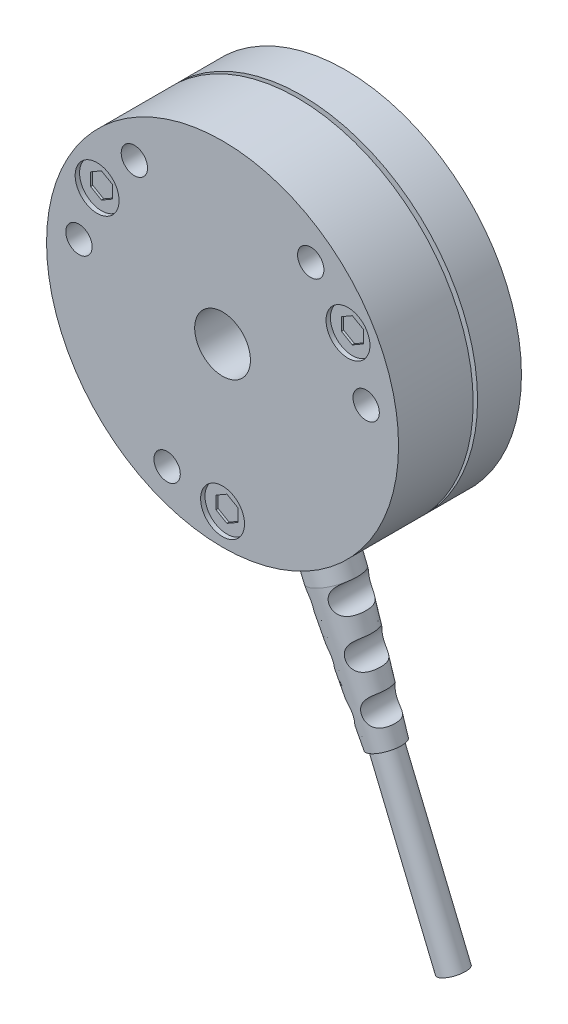
from build123d import *

# Parameters (mm, degrees)
SKETCH1_R           = 20.05
BOSS_EXTRUDE1_DEPTH = 5
SKETCH2_R           = 18.5
BOSS_EXTRUDE2_DEPTH = 0.5
SKETCH3_R           = 20.05
BOSS_EXTRUDE3_DEPTH = 8.5
SKETCH4_R           = 2.65
BOSS_EXTRUDE4_DEPTH = 37.35
CHAMFER1_SIZE       = 15
CHAMFER1_SIZE2      = 0.786116689
SKETCH5_R           = 1.5
BOSS_EXTRUDE5_DEPTH = 20
SKETCH6_R           = 1.5
CUT_EXTRUDE1_DEPTH  = 61.074372444
SKETCH9_R           = 2.5
CUT_EXTRUDE2_DEPTH  = 0.5
CUT_EXTRUDE3_DEPTH  = 0.25
SKETCH11_R          = 3.175
CUT_EXTRUDE4_DEPTH  = 61.07437242
SKETCH12_R          = 1.5
CUT_EXTRUDE5_DEPTH  = 5
SKETCH13_R          = 1.5
CUT_EXTRUDE6_DEPTH  = 5
SKETCH14_R          = 1.5
CUT_EXTRUDE7_DEPTH  = 5
SKETCH15_R          = 1.5
CUT_EXTRUDE8_DEPTH  = 5
SKETCH16_R          = 3.5
CUT_EXTRUDE9_DEPTH  = 0.5
CUT_EXTRUDE10_DEPTH = 0.25


with BuildPart() as part:
    # Sketch1 → Boss-Extrude1 (new body)
    with BuildSketch(Plane.XY):
        Circle(SKETCH1_R)
    extrude(amount=BOSS_EXTRUDE1_DEPTH)

    # Sketch2 → Boss-Extrude2 (add)
    with BuildSketch(Plane.XY.offset(5)):
        Circle(SKETCH2_R)
    extrude(amount=BOSS_EXTRUDE2_DEPTH)

    # Sketch3 → Boss-Extrude3 (add)
    with BuildSketch(Plane.XY.offset(5.5)):
        Circle(SKETCH3_R)
    extrude(amount=BOSS_EXTRUDE3_DEPTH)

    # Sketch4 → Boss-Extrude4 (add)
    with BuildSketch(Plane(origin=(0, 0, 0), x_dir=(0.9238795325112865, 0.38268343236509045, 0), z_dir=(-0.38268343236509045, 0.9238795325112865, 0))):
        with Locations((0, -9.65)):
            Circle(SKETCH4_R)
    extrude(amount=-BOSS_EXTRUDE4_DEPTH)

    # Chamfer1
    chamfer1_edges = [part.edges().sort_by_distance(p)[0] for p in [
        (11.844945438, -35.521011635, 9.65),
    ]]
    chamfer1_side = [part.faces().sort_by_distance(p)[0] for p in [
        (8.500185155, -27.446045997, 9.65),
    ]]
    chamfer(chamfer1_edges, length=CHAMFER1_SIZE, length2=CHAMFER1_SIZE2, reference=chamfer1_side[0])

    # Sketch5 → Boss-Extrude5 (add)
    with BuildSketch(Plane(origin=(14.293226199, -34.506900539, 0), x_dir=(-0.9238795325112865, -0.38268343236509045, 0), z_dir=(0.38268343236509045, -0.9238795325112865, 0))):
        with Locations((0, -9.65)):
            Circle(SKETCH5_R)
    extrude(amount=BOSS_EXTRUDE5_DEPTH)

    # Sketch6 → Cut-Extrude1 (cut, through all)
    with BuildSketch(Plane.XY):
        with Locations((11.501965763, -21.048558692)):
            Circle(SKETCH6_R)
        with Locations((13.173290552, -25.768234299)):
            Circle(SKETCH6_R)
        with Locations((14.844615341, -30.487909906)):
            Circle(SKETCH6_R)
        with Locations((11.061479667, -32.05493601)):
            Circle(SKETCH6_R)
        with Locations((8.905970132, -27.535816292)):
            Circle(SKETCH6_R)
        with Locations((6.750460597, -23.016696574)):
            Circle(SKETCH6_R)
    extrude(amount=CUT_EXTRUDE1_DEPTH, mode=Mode.SUBTRACT)

    # Sketch9 → Cut-Extrude2 (cut)
    with BuildSketch(Plane.XY.offset(14)):
        with Locations((0, -16.5)):
            Circle(SKETCH9_R)
        with Locations((-14.289419162, 8.25)):
            Circle(SKETCH9_R)
        with Locations((14.289419162, 8.25)):
            Circle(SKETCH9_R)
    extrude(amount=-CUT_EXTRUDE2_DEPTH, mode=Mode.SUBTRACT)

    # Sketch10 → Cut-Extrude3 (cut)
    with BuildSketch(Plane.XY.offset(13.5)):
        Polygon((-15.539419162, 8.971687836), (-15.539419162, 7.528312164), (-14.289419162, 6.806624327), (-13.039419162, 7.528312164), (-13.039419162, 8.971687836), (-14.289419162, 9.693375673), align=None)
        Polygon((0, -17.943375673), (1.25, -17.221687836), (1.25, -15.778312164), (0, -15.056624327), (-1.25, -15.778312164), (-1.25, -17.221687836), align=None)
        Polygon((15.539419162, 8.971687836), (14.289419162, 9.693375673), (13.039419162, 8.971687836), (13.039419162, 7.528312164), (14.289419162, 6.806624327), (15.539419162, 7.528312164), align=None)
    extrude(amount=-CUT_EXTRUDE3_DEPTH, mode=Mode.SUBTRACT)

    # Sketch11 → Cut-Extrude4 (cut, through all)
    with BuildSketch(Plane.XY.offset(14)):
        Circle(SKETCH11_R)
    extrude(amount=-CUT_EXTRUDE4_DEPTH, mode=Mode.SUBTRACT)

    # Sketch12 → Cut-Extrude5 (cut)
    with BuildSketch(Plane.XY.offset(14)):
        with Locations((-6.314276634, -15.244012286)):
            Circle(SKETCH12_R)
        with Locations((-10.044563579, 13.090330115)):
            Circle(SKETCH12_R)
        with Locations((16.358840213, 2.153682172)):
            Circle(SKETCH12_R)
    extrude(amount=-CUT_EXTRUDE5_DEPTH, mode=Mode.SUBTRACT)

    # Sketch13 → Cut-Extrude6 (cut)
    with BuildSketch(Plane.XY.offset(14)):
        with Locations((-16.358840213, 2.153682172)):
            Circle(SKETCH13_R)
        with Locations((10.044563579, 13.090330115)):
            Circle(SKETCH13_R)
    extrude(amount=-CUT_EXTRUDE6_DEPTH, mode=Mode.SUBTRACT)

    # Sketch14 → Cut-Extrude7 (cut)
    with BuildSketch(Plane(origin=(0, 0, 0), x_dir=(-1, 0, 0), z_dir=(0, 0, -1))):
        with Locations((0, -16.5)):
            Circle(SKETCH14_R)
        with Locations((-14.289419162, 8.25)):
            Circle(SKETCH14_R)
        with Locations((14.289419162, 8.25)):
            Circle(SKETCH14_R)
    extrude(amount=-CUT_EXTRUDE7_DEPTH, mode=Mode.SUBTRACT)

    # Sketch15 → Cut-Extrude8 (cut)
    with BuildSketch(Plane(origin=(0, 0, 0), x_dir=(-1, 0, 0), z_dir=(0, 0, -1))):
        with Locations((0, 17.5)):
            Circle(SKETCH15_R)
        with Locations((-15.155444566, -8.75)):
            Circle(SKETCH15_R)
    extrude(amount=-CUT_EXTRUDE8_DEPTH, mode=Mode.SUBTRACT)

    # Sketch16 → Cut-Extrude9 (cut)
    with BuildSketch(Plane(origin=(0, 0, 0), x_dir=(-1, 0, 0), z_dir=(0, 0, -1))):
        with Locations((0, -7.5)):
            Circle(SKETCH16_R)
        with Locations((-6.495190528, 3.75)):
            Circle(SKETCH16_R)
        with Locations((6.495190528, 3.75)):
            Circle(SKETCH16_R)
    extrude(amount=-CUT_EXTRUDE9_DEPTH, mode=Mode.SUBTRACT)

    # Sketch17 → Cut-Extrude10 (cut)
    with BuildSketch(Plane(origin=(0, 0, 0.5), x_dir=(-1, 0, 0), z_dir=(0, 0, -1))):
        Polygon((-7.745190528, 4.471687836), (-7.745190528, 3.028312164), (-6.495190528, 2.306624327), (-5.245190528, 3.028312164), (-5.245190528, 4.471687836), (-6.495190528, 5.193375673), align=None)
        Polygon((0, -8.943375673), (1.25, -8.221687836), (1.25, -6.778312164), (0, -6.056624327), (-1.25, -6.778312164), (-1.25, -8.221687836), align=None)
        Polygon((7.745190528, 4.471687836), (6.495190528, 5.193375673), (5.245190528, 4.471687836), (5.245190528, 3.028312164), (6.495190528, 2.306624327), (7.745190528, 3.028312164), align=None)
    extrude(amount=-CUT_EXTRUDE10_DEPTH, mode=Mode.SUBTRACT)


solid = part.part
